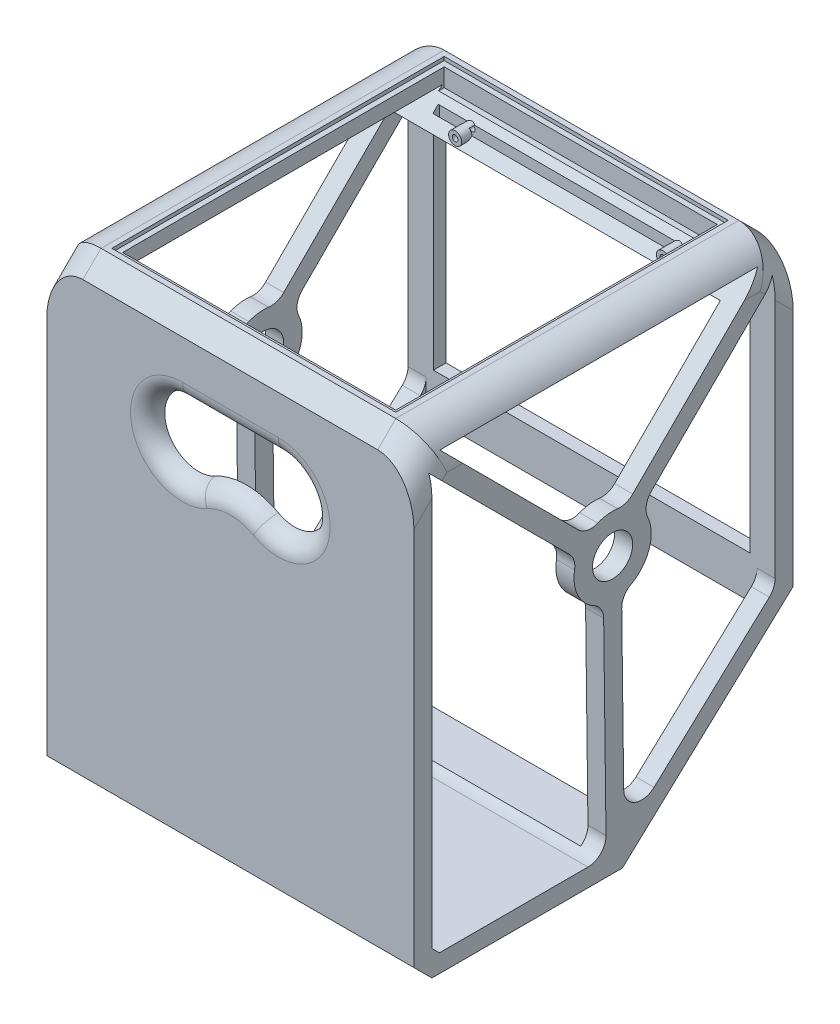
from build123d import *

# Parameters (mm, degrees)
PROFILE_R                 = 11.1125
BOSS_EXTRUDE1_DEPTH       = 203.2
CUT_EXTRUDE_EYEPORT_DEPTH = 10
FILLET1_R                 = 20
FILLET2_R                 = 10
FILLET3_R                 = 10
INTERIOR_W                = 183.2
INTERIOR_H                = 222.972657995
CUT_EXTRUDE2_DEPTH        = 191
DISPLAYMOUNT_R            = 3.6
DISPLAYMOUNT_R_2          = 1.6
BOSS_EXTRUDE2_DEPTH       = 16
SKETCH10_R                = 1.6
CUT_EXTRUDE3_DEPTH        = 19
SKETCH11_W                = 145.2
SKETCH11_H                = 3.787943236
CUT_EXTRUDE4_DEPTH        = 8
BOLTHOLE_W                = 7.7
BOLTHOLE_H                = 7.731991347
CUT_EXTRUDE5_DEPTH        = 4
CUT_EXTRUDE6_DEPTH        = 3
CUT_EXTRUDE7_DEPTH        = 7
SKETCH19_W                = 157.2
SKETCH19_H                = 184
CUT_EXTRUDE10_DEPTH       = 2
SKETCH20_W                = 151.2
SKETCH20_H                = 178
CUT_EXTRUDE11_DEPTH       = 10
FILLET4_R                 = 10


# Some blends are built 0.0001 mm under size
with BuildPart() as part:
    # Profile → Boss-Extrude1 (new body)
    with BuildSketch(Plane(origin=(0, 0, 0), x_dir=(0, 0, -1), z_dir=(1, 0, 0))):
        Polygon((0, 248.232732248), (10, 258.232732248), (200, 258.232732248), (210, 248.232732248), (210, 87.805670423), (115.430840334, 0), (10, 0), (0, 10), align=None)
        with Locations((110, 152.4)):
            Circle(PROFILE_R, mode=Mode.SUBTRACT)
        with BuildLine():
            Line((17.071067812, 248.232732248), (192.928932188, 248.232732248))
            Line((192.928932188, 248.232732248), (118.384212734, 173.688012794))
            Line((118.384212734, 173.688012794), (117.222470863, 172.526270923))
            ThreePointArc((117.222470863, 172.526270923), (106.333066326, 173.466192444), (96.401736588, 168.902063472))
            Line((96.401736588, 168.902063472), (17.071067812, 248.232732248))
        make_face(mode=Mode.SUBTRACT)
        with BuildLine():
            Line((200, 92.166654443), (200, 241.161664436))
            Line((200, 241.161664436), (125.726519124, 166.888183561))
            ThreePointArc((125.726519124, 166.888183561), (130.458133202, 146.179417026), (114.999613795, 131.609744385))
            Line((114.999613795, 131.609744385), (114.999613795, 131.079186829))
            Line((114.999613795, 131.079186829), (116.447554057, 14.589793684))
            Line((116.447554057, 14.589793684), (200, 92.166654443))
        make_face(mode=Mode.SUBTRACT)
        with BuildLine():
            Line((14.142135624, 10), (106.503831821, 10))
            Line((106.503831821, 10), (105.000386205, 130.954898395))
            Line((105.000386205, 130.954898395), (105.000386205, 131.609744385))
            ThreePointArc((105.000386205, 131.609744385), (90.888278858, 142.809745486), (90.343724725, 160.817939711))
            Line((90.343724725, 160.817939711), (89.405055003, 161.756609433))
            Line((89.405055003, 161.756609433), (10, 241.161664436))
            Line((10, 241.161664436), (10, 14.142135624))
            Line((10, 14.142135624), (14.142135624, 10))
        make_face(mode=Mode.SUBTRACT)
    extrude(amount=BOSS_EXTRUDE1_DEPTH)

    # Eyeport → Cut-Extrude - Eyeport (cut)
    with BuildSketch(Plane.XY):
        with BuildLine():
            Line((75, 216.590857994), (128.2, 216.590857994))
            ThreePointArc((128.2, 216.590857994), (146.26319193, 193.273465676), (119.171437061, 181.610854249))
            ThreePointArc((119.171437061, 181.610854249), (101.6, 186.146154662), (84.028562939, 181.610854249))
            ThreePointArc((84.028562939, 181.610854249), (56.93680807, 193.273465676), (75, 216.590857994))
        make_face()
    extrude(amount=-CUT_EXTRUDE_EYEPORT_DEPTH, mode=Mode.SUBTRACT)

    # Fillet1
    # the kernel refuses this fillet: 20 mm, written as the material it takes off along each edge
    with BuildSketch(Plane(origin=(203.2, 293.588071308, -164.644660941), x_dir=(0, -0.7071067811865486, 0.7071067811865466), z_dir=(0, -0.7071067811865466, -0.7071067811865486)), Plane(origin=(0, 212.877393189, 35.355339059), x_dir=(1, 0, 0), z_dir=(0, 0.7071067811865476, -0.7071067811865476))) as fillet1_piece_1:
        with BuildLine():
            CenterArc((FILLET1_R, FILLET1_R), FILLET1_R, 180, 90)
            Line((0, FILLET1_R), (0, 0))
            Line((0, 0), (FILLET1_R, 0))
        make_face()
    extrude(amount=114.142135624, mode=Mode.SUBTRACT)
    with BuildSketch(Plane(origin=(0, 293.588071308, -164.644660941), x_dir=(0, -0.7071067811865486, 0.7071067811865466), z_dir=(0, -0.7071067811865466, -0.7071067811865486)), Plane(origin=(203.2, 212.877393189, 35.355339059), x_dir=(-1, 0, 0), z_dir=(0, 0.7071067811865476, -0.7071067811865476))) as fillet1_piece_2:
        with BuildLine():
            CenterArc((FILLET1_R, -FILLET1_R), FILLET1_R, 90, 90)
            Line((0, -FILLET1_R), (0, 0))
            Line((0, 0), (FILLET1_R, 0))
        make_face()
    extrude(amount=114.142135624, mode=Mode.SUBTRACT)
    with BuildSketch(Plane(origin=(203.2, 258.232732248, 40), x_dir=(-1, 0, 0), z_dir=(0, 0, -1))) as fillet1_piece_3:
        with BuildLine():
            CenterArc((FILLET1_R, -FILLET1_R), FILLET1_R, 90, 90)
            Line((0, -FILLET1_R), (0, 0))
            Line((0, 0), (FILLET1_R, 0))
        make_face()
    extrude(amount=290, mode=Mode.SUBTRACT)
    with BuildSketch(Plane(origin=(0, 258.232732248, 40), x_dir=(1, 0, 0), z_dir=(0, 0, -1))) as fillet1_piece_4:
        with BuildLine():
            CenterArc((FILLET1_R, FILLET1_R), FILLET1_R, 180, 90)
            Line((0, FILLET1_R), (0, 0))
            Line((0, 0), (FILLET1_R, 0))
        make_face()
    extrude(amount=290, mode=Mode.SUBTRACT)

    # Fillet2
    fillet2_edges = [part.edges().sort_by_distance(p)[0] for p in [
        (101.6, 131.609744385, -105.000386205),
        (101.6, 131.609744385, -114.999613795),
        (101.6, 166.888183561, -125.726519124),
        (101.6, 160.817939711, -90.343724725),
        (101.6, 168.902063472, -96.401736588),
        (101.6, 172.526270923, -117.222470863),
    ]]
    fillet(fillet2_edges, radius=FILLET2_R)

    # Fillet3
    fillet3_edges = [part.edges().sort_by_distance(p)[0] for p in [
        (101.6, 216.590857994, 0),
        (146.26319193, 193.273465676, 0),
        (101.6, 186.146154662, 0),
        (56.93680807, 193.273465676, 0),
    ]]
    fillet(fillet3_edges, radius=FILLET3_R - 0.0001)  # a hair under: the kernel refuses the full size

    # Interior → Cut-Extrude2 (cut)
    with BuildSketch(Plane.XY.offset(-200)):
        with Locations((101.6, 123.486328998)):
            Rectangle(INTERIOR_W, INTERIOR_H)
    extrude(amount=CUT_EXTRUDE2_DEPTH, mode=Mode.SUBTRACT)

    # DisplayMount → Boss-Extrude2 (add)
    # profile 1 of 2: a face of its own
    with BuildSketch(Plane(origin=(0, 0, -179.012011391), x_dir=(-1, 0, 0), z_dir=(0, 0, -1))):
        with Locations(Location((-162.04400772, 240.027868216, 0), (0, 0, 270))):
            Circle(DISPLAYMOUNT_R)
        with Locations(Location((-162.04400772, 240.027868216, 0), (0, 0, 270))):
            Circle(DISPLAYMOUNT_R_2, mode=Mode.SUBTRACT)
    # profile 2 of 2: a face of its own
    with BuildSketch(Plane(origin=(0, 0, -179.012011391), x_dir=(-1, 0, 0), z_dir=(0, 0, -1))):
        with Locations(Location((-47.04400772, 240.027868216, 0), (0, 0, 270))):
            Circle(DISPLAYMOUNT_R)
        with Locations(Location((-47.04400772, 240.027868216, 0), (0, 0, 270))):
            Circle(DISPLAYMOUNT_R_2, mode=Mode.SUBTRACT)
    extrude(amount=BOSS_EXTRUDE2_DEPTH)

    # Sketch10 → Cut-Extrude3 (cut)
    with BuildSketch(Plane(origin=(0, 0, -179.012011391), x_dir=(-1, 0, 0), z_dir=(0, 0, -1))):
        with Locations(Location((-162.04400772, 240.027868216, 0), (0, 0, 212.267326462))):
            Circle(SKETCH10_R)
        with Locations(Location((-47.04400772, 240.027868216, 0), (0, 0, 212.267326462))):
            Circle(SKETCH10_R)
    extrude(amount=CUT_EXTRUDE3_DEPTH, mode=Mode.SUBTRACT)

    # Sketch11 → Cut-Extrude4 (cut)
    with BuildSketch(Plane.XZ.offset(-234.972657995)):
        with Locations((101.6, -186.618039773)):
            Rectangle(SKETCH11_W, SKETCH11_H)
    extrude(amount=-CUT_EXTRUDE4_DEPTH, mode=Mode.SUBTRACT)

    # Bolthole → Cut-Extrude5 (cut)
    with BuildSketch(Plane.XY.offset(-198.012011391)):
        with Locations((47.04400772, 240.027868216)):
            Rectangle(BOLTHOLE_W, BOLTHOLE_H)
        with Locations((162.04400772, 240.027868216)):
            Rectangle(BOLTHOLE_W, BOLTHOLE_H)
    extrude(amount=CUT_EXTRUDE5_DEPTH, mode=Mode.SUBTRACT)

    # Sketch14 → Cut-Extrude6 (cut)
    with BuildSketch(Plane(origin=(0, 0, -210), x_dir=(-1, 0, 0), z_dir=(0, 0, -1))):
        Polygon((-193.2, 219.948461001), (-182.413133958, 233.621872542), (-20.786866042, 233.621872542), (-10, 219.948461001), (-10, 97.805670423), (-193.2, 97.805670423), align=None)
    extrude(amount=-CUT_EXTRUDE6_DEPTH, mode=Mode.SUBTRACT)

    # Sketch16 → Cut-Extrude7 (cut)
    with BuildSketch(Plane(origin=(0, 0, -207), x_dir=(-1, 0, 0), z_dir=(0, 0, -1))):
        Polygon((-189.2, 218.560612276), (-189.2, 101.805670423), (-14, 101.805670423), (-14, 218.560612276), (-22.726156775, 229.621872542), (-180.473843225, 229.621872542), align=None)
    extrude(amount=-CUT_EXTRUDE7_DEPTH, mode=Mode.SUBTRACT)

    # Sketch19 → Cut-Extrude10 (cut)
    with BuildSketch(Plane(origin=(0, 258.232732248, 0), x_dir=(1, 0, 0), z_dir=(0, 1, 0))):
        with Locations((101.6, 105)):
            Rectangle(SKETCH19_W, SKETCH19_H)
    extrude(amount=-CUT_EXTRUDE10_DEPTH, mode=Mode.SUBTRACT)

    # Sketch20 → Cut-Extrude11 (cut)
    with BuildSketch(Plane(origin=(0, 256.232732248, 0), x_dir=(1, 0, 0), z_dir=(0, 1, 0))):
        with Locations((101.6, 105)):
            Rectangle(SKETCH20_W, SKETCH20_H)
    extrude(amount=-CUT_EXTRUDE11_DEPTH, mode=Mode.SUBTRACT)

    # Fillet4
    # the kernel refuses this fillet: 10 mm, written as the material it adds along each edge
    with BuildSketch(Plane(origin=(0, 10, -106.503831821), x_dir=(0, 0, 1), z_dir=(1, 0, 0))) as fillet4_piece_1_section:
        with BuildLine():
            CenterArc((FILLET4_R * 1.01250705049, -FILLET4_R), FILLET4_R, 90, 90.712138605)
            Line((FILLET4_R * 0.0125842915471, -FILLET4_R * 1.01242884338), (0, 0))
            Line((0, 0), (FILLET4_R * 1.01250705049, 0))
        make_face()
    fillet4_piece_1 = extrude(amount=203.2, mode=Mode.PRIVATE)
    fillet4_piece_1 = split(fillet4_piece_1, bisect_by=Plane(origin=(10, 10.734381859, -103.154099075), z_dir=(-1, 0, 0)), keep=Keep.TOP, mode=Mode.PRIVATE)
    fillet4_piece_1 = split(fillet4_piece_1, bisect_by=Plane(origin=(5, 12, -103.154099075), z_dir=(0, -1, 0)), keep=Keep.TOP, mode=Mode.PRIVATE)
    add(fillet4_piece_1)
    with BuildSketch(Plane(origin=(0, 10, -106.503831821), x_dir=(0, 0, 1), z_dir=(1, 0, 0))) as fillet4_piece_2_section:
        with BuildLine():
            CenterArc((FILLET4_R * 1.01250705049, -FILLET4_R), FILLET4_R, 90, 90.712138605)
            Line((FILLET4_R * 0.0125842915471, -FILLET4_R * 1.01242884338), (0, 0))
            Line((0, 0), (FILLET4_R * 1.01250705049, 0))
        make_face()
    fillet4_piece_2 = extrude(amount=203.2, mode=Mode.PRIVATE)
    fillet4_piece_2 = split(fillet4_piece_2, bisect_by=Plane(origin=(10, 14.237899365, -105.456108312), z_dir=(-1, 0, 0)), keep=Keep.TOP, mode=Mode.PRIVATE)
    fillet4_piece_2 = split(fillet4_piece_2, bisect_by=Plane(origin=(5, 12, -105.456108312), z_dir=(0, 1, 0)), keep=Keep.TOP, mode=Mode.PRIVATE)
    add(fillet4_piece_2)
    with BuildSketch(Plane(origin=(0, 10, -106.503831821), x_dir=(0, 0, 1), z_dir=(1, 0, 0))) as fillet4_piece_3_section:
        with BuildLine():
            CenterArc((FILLET4_R * 1.01250705049, -FILLET4_R), FILLET4_R, 90, 90.712138605)
            Line((FILLET4_R * 0.0125842915471, -FILLET4_R * 1.01242884338), (0, 0))
            Line((0, 0), (FILLET4_R * 1.01250705049, 0))
        make_face()
    fillet4_piece_3 = extrude(amount=203.2, mode=Mode.PRIVATE)
    fillet4_piece_3 = split(fillet4_piece_3, bisect_by=Plane(origin=(10, 10.734381859, -103.154099075), z_dir=(1, 0, 0)), keep=Keep.TOP, mode=Mode.PRIVATE)
    fillet4_piece_3 = split(fillet4_piece_3, bisect_by=Plane(origin=(101.6, 12, -103.154099075), z_dir=(0, -1, 0)), keep=Keep.TOP, mode=Mode.PRIVATE)
    fillet4_piece_3 = split(fillet4_piece_3, bisect_by=Plane(origin=(193.2, 10.734381859, -103.154099075), z_dir=(-1, 0, 0)), keep=Keep.TOP, mode=Mode.PRIVATE)
    add(fillet4_piece_3)
    with BuildSketch(Plane(origin=(0, 10, -106.503831821), x_dir=(0, 0, 1), z_dir=(1, 0, 0))) as fillet4_piece_4_section:
        with BuildLine():
            CenterArc((FILLET4_R * 1.01250705049, -FILLET4_R), FILLET4_R, 90, 90.712138605)
            Line((FILLET4_R * 0.0125842915471, -FILLET4_R * 1.01242884338), (0, 0))
            Line((0, 0), (FILLET4_R * 1.01250705049, 0))
        make_face()
    fillet4_piece_4 = extrude(amount=203.2, mode=Mode.PRIVATE)
    fillet4_piece_4 = split(fillet4_piece_4, bisect_by=Plane(origin=(198.2, 12, -103.154099075), z_dir=(0, -1, 0)), keep=Keep.TOP, mode=Mode.PRIVATE)
    fillet4_piece_4 = split(fillet4_piece_4, bisect_by=Plane(origin=(193.2, 10.734381859, -103.154099075), z_dir=(1, 0, 0)), keep=Keep.TOP, mode=Mode.PRIVATE)
    add(fillet4_piece_4)
    with BuildSketch(Plane(origin=(0, 10, -106.503831821), x_dir=(0, 0, 1), z_dir=(1, 0, 0))) as fillet4_piece_5_section:
        with BuildLine():
            CenterArc((FILLET4_R * 1.01250705049, -FILLET4_R), FILLET4_R, 90, 90.712138605)
            Line((FILLET4_R * 0.0125842915471, -FILLET4_R * 1.01242884338), (0, 0))
            Line((0, 0), (FILLET4_R * 1.01250705049, 0))
        make_face()
    fillet4_piece_5 = extrude(amount=203.2, mode=Mode.PRIVATE)
    fillet4_piece_5 = split(fillet4_piece_5, bisect_by=Plane(origin=(198.2, 12, -105.456108312), z_dir=(0, 1, 0)), keep=Keep.TOP, mode=Mode.PRIVATE)
    fillet4_piece_5 = split(fillet4_piece_5, bisect_by=Plane(origin=(193.2, 14.237899365, -105.456108312), z_dir=(1, 0, 0)), keep=Keep.TOP, mode=Mode.PRIVATE)
    add(fillet4_piece_5)
    with BuildSketch(Plane(origin=(0, 14.589793684, -116.447554057), x_dir=(0, 0.9999227589430834, 0.012428843375487733), z_dir=(1, 0, 0)), Plane(origin=(193.2, 14.589793684, -116.447554057), x_dir=(0, 0.9999227589430834, 0.012428843375487733), z_dir=(1, 0, 0))) as fillet4_piece_6:
        with BuildLine():
            CenterArc((FILLET4_R * 2.25471476598, -FILLET4_R), FILLET4_R, 90, 132.163983462)
            Line((FILLET4_R * 1.5134880677, -FILLET4_R * 1.67125478155), (0, 0))
            Line((0, 0), (FILLET4_R * 2.25471476598, 0))
        make_face()
    extrude(amount=10)
    with BuildSketch(Plane(origin=(0, 92.166654443, -200), x_dir=(0, -0.6804155236626022, 0.7328265246011136), z_dir=(1, 0, 0))) as fillet4_piece_7:
        with BuildLine():
            CenterArc((FILLET4_R * 0.436098402021, -FILLET4_R), FILLET4_R, 90, 47.123877933)
            Line((-FILLET4_R * 0.29672812258, -FILLET4_R * 0.319584476337), (0, 0))
            Line((0, 0), (FILLET4_R * 0.436098402021, 0))
        make_face()
    extrude(amount=10)
    with BuildSketch(Plane(origin=(193.2, 92.166654443, -200), x_dir=(0, 1, 0), z_dir=(1, 0, 0))) as fillet4_piece_8:
        with BuildLine():
            CenterArc((FILLET4_R * 0.436098402021, FILLET4_R), FILLET4_R, 222.876122067, 47.123877933)
            Line((-FILLET4_R * 0.29672812258, FILLET4_R * 0.319584476337), (0, 0))
            Line((0, 0), (FILLET4_R * 0.436098402021, 0))
        make_face()
    extrude(amount=10)


solid = part.part
